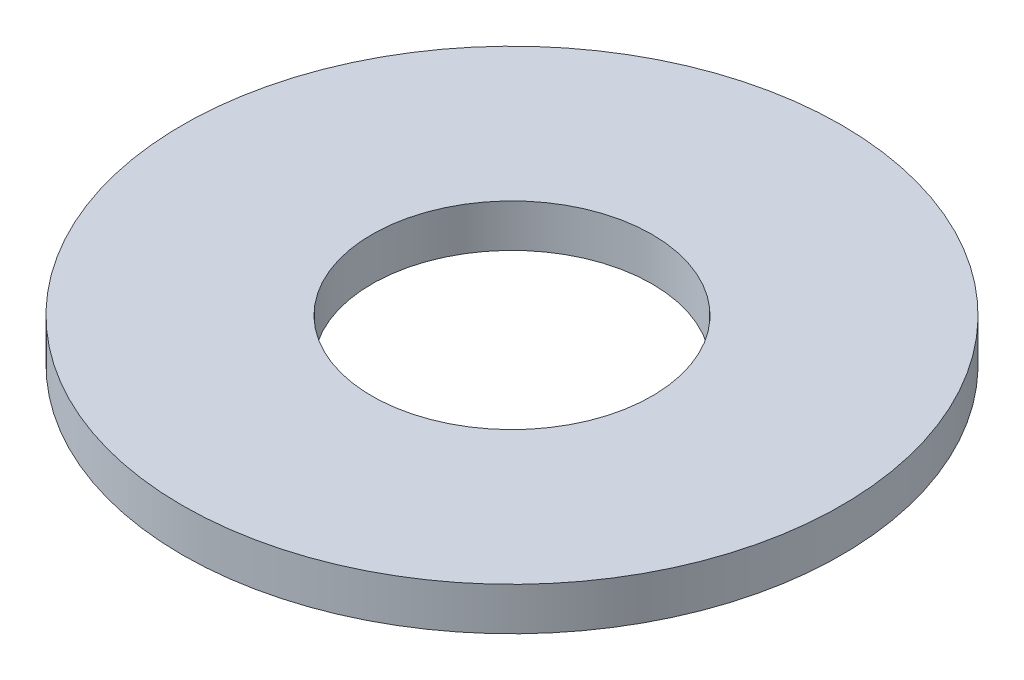
from build123d import *

# Parameters (mm, degrees)
SKETCH1_R           = 100
BOSS_EXTRUDE1_DEPTH = 13
SKETCH2_R           = 42.5
CUT_EXTRUDE1_DEPTH  = 143.017604543


with BuildPart() as part:
    # Sketch1 → Boss-Extrude1 (new body)
    with BuildSketch(Plane(origin=(0, 0, 0), x_dir=(1, 0, 0), z_dir=(0, 1, 0))):
        Circle(SKETCH1_R)
    extrude(amount=BOSS_EXTRUDE1_DEPTH)

    # Sketch2 → Cut-Extrude1 (cut, through all)
    with BuildSketch(Plane(origin=(0, 0, 0), x_dir=(1, 0, 0), z_dir=(0, 1, 0))):
        Circle(SKETCH2_R)
    extrude(amount=CUT_EXTRUDE1_DEPTH, mode=Mode.SUBTRACT)


solid = part.part
